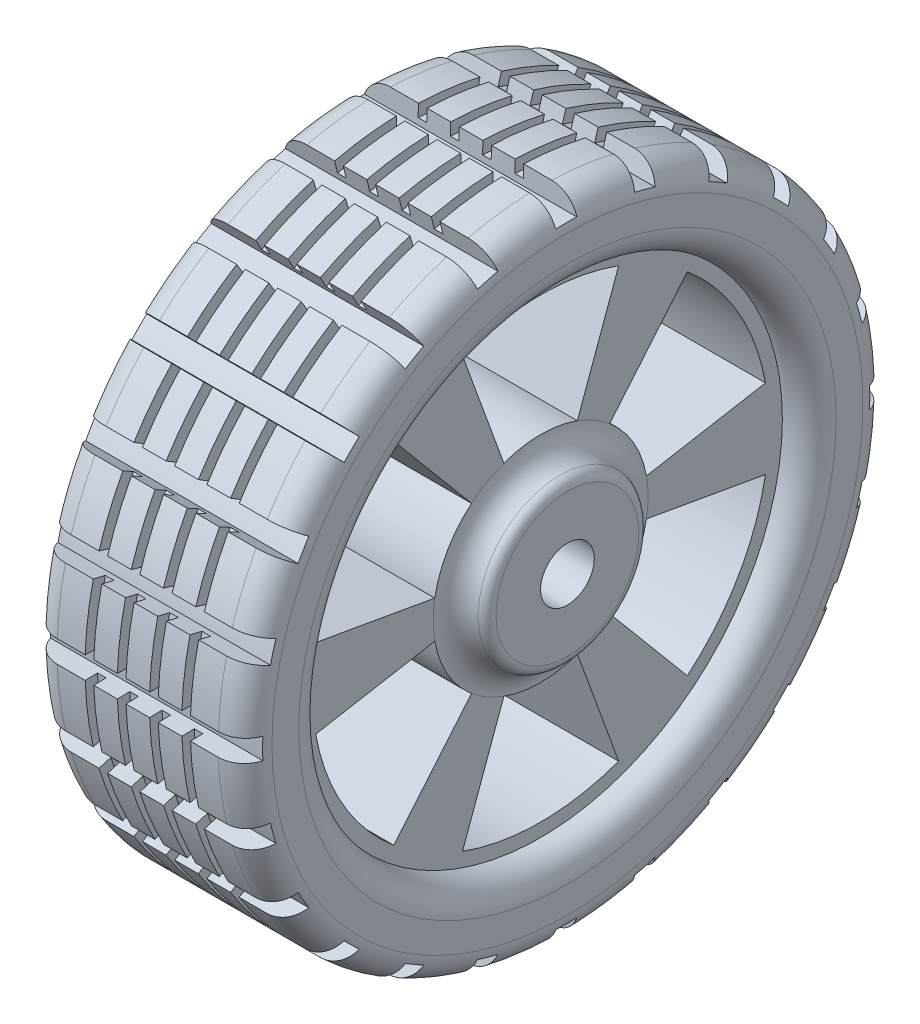
from build123d import *

# Parameters (mm, degrees)
SKETCH_2_W               = 40
SKETCH_2_H               = 60
SKETCH_4_R               = 5
CUT_EXTRUDE_2_DEPTH      = 93
FILLET_1_R               = 5
FILLET_2_R               = 5
SKETCH_5_R               = 45
SKETCH_5_R_2             = 15
CUT_EXTRUDE_3_DEPTH      = 5
FILLET_3_R               = 5
FILLET_4_R               = 5
FILLET_5_R               = 3
FILLET_6_R               = 5
PATTERN_LINEAR_1_COUNT   = 4
PATTERN_LINEAR_1_PITCH   = 6
CUT_EXTRUDE_4_DEPTH      = 116.325625947
PATTERN_START            = -19.769696137
PATTERN_CIRCULAR_1_DEPTH = 39.539392144
CUT_EXTRUDE_6_DEPTH      = 114.641343281
PATTERN_CIRCULAR_2_COUNT = 6
FILLET_7_R               = 2


# Read off the part's stored shape, not the designer's step: 阵列(圆周)1
with BuildPart() as part:
    # 草图2 → 旋转1 (revolve)
    with BuildSketch(Plane.XY, mode=Mode.PRIVATE) as revolve_1_sk:
        Rectangle(SKETCH_2_W, SKETCH_2_H)
    revolve(revolve_1_sk.sketch.rotate(Axis((-20, -30, 0), (1, 0, 0)), 90), axis=Axis((-20, -30, 0), (1, 0, 0)))

    # 草图4 → 切除-拉伸2 (cut)
    with BuildSketch(Plane(origin=(20, 0, 0), x_dir=(0, 0, -1), z_dir=(1, 0, 0))):
        with Locations((0, -30)):
            Circle(SKETCH_4_R)
    extrude(amount=-CUT_EXTRUDE_2_DEPTH, mode=Mode.SUBTRACT)

    # 圆角1
    fillet_1_edges = [part.edges().sort_by_distance(p)[0] for p in [
        (20, -30, -60),
    ]]
    fillet(fillet_1_edges, radius=FILLET_1_R)

    # 圆角2
    fillet_2_edges = [part.edges().sort_by_distance(p)[0] for p in [
        (-20, -30, -60),
    ]]
    fillet(fillet_2_edges, radius=FILLET_2_R)

    # 草图5 → 切除-拉伸3 (cut)
    with BuildSketch(Plane(origin=(20, 0, 0), x_dir=(0, 0, -1), z_dir=(1, 0, 0))):
        with Locations((0, -30)):
            Circle(SKETCH_5_R)
        with Locations((0, -30)):
            Circle(SKETCH_5_R_2, mode=Mode.SUBTRACT)
    cut_extrude_3 = extrude(amount=-CUT_EXTRUDE_3_DEPTH, mode=Mode.SUBTRACT)

    # 镜向1: 切除-拉伸3 across plane
    add(cut_extrude_3.mirror(Plane(origin=(0, 0, 0), x_dir=(0, 0, 1), z_dir=(1, 0, 0))), mode=Mode.SUBTRACT)

    # 圆角3
    fillet_3_edges = [part.edges().sort_by_distance(p)[0] for p in [
        (20, -30, 45),
    ]]
    fillet(fillet_3_edges, radius=FILLET_3_R - 0.0001)  # a hair under: the kernel refuses the full size

    # 圆角4
    fillet_4_edges = [part.edges().sort_by_distance(p)[0] for p in [
        (15, -30, 15),
    ]]
    fillet(fillet_4_edges, radius=FILLET_4_R - 0.0001)  # a hair under: the kernel refuses the full size

    # 圆角5
    fillet_5_edges = [part.edges().sort_by_distance(p)[0] for p in [
        (-15, -30, 15),
    ]]
    fillet(fillet_5_edges, radius=FILLET_5_R)

    # 圆角6
    fillet_6_edges = [part.edges().sort_by_distance(p)[0] for p in [
        (-20, -30, 45),
    ]]
    fillet(fillet_6_edges, radius=FILLET_6_R - 0.0001)  # a hair under: the kernel refuses the full size

    # 草图8 → 切除-旋转1 (revolve, cut)
    with BuildSketch(Plane.XY, mode=Mode.PRIVATE) as cut_revolve_1_sk:
        Polygon((-9.8, 27.7), (-8.2, 27.7), (-8.2, 30), (-9, 30), (-9.8, 30), align=None)
    cut_revolve_1 = revolve(cut_revolve_1_sk.sketch.rotate(Axis((-20, -30, 0), (1, 0, 0)), 90), axis=Axis((-20, -30, 0), (1, 0, 0)), mode=Mode.SUBTRACT)

    # 阵列(线性)1: 切除-旋转1 ×4
    with Locations(*[(i * PATTERN_LINEAR_1_PITCH, 0, 0) for i in range(1, PATTERN_LINEAR_1_COUNT)]):
        add(cut_revolve_1, mode=Mode.SUBTRACT)

    # 草图9 → 切除-拉伸4 (cut, through all)
    with BuildSketch(Plane.ZY.offset(20)):
        with BuildLine():
            Line((1.971821564, 26.465581727), (2.063444168, 29.964507821))
            ThreePointArc((2.063444168, 29.964507821), (0, 30), (-2.063444168, 29.964507821))
            Line((-2.063444168, 29.964507821), (-1.971821564, 26.465581727))
            ThreePointArc((-1.971821564, 26.465581727), (0, 26.5), (1.971821564, 26.465581727))
        make_face()
    extrude(amount=-CUT_EXTRUDE_4_DEPTH, mode=Mode.SUBTRACT)

    # 阵列(圆周)1 outline → 阵列(圆周)1 (cut)
    with BuildSketch(Plane.YZ.offset(PATTERN_START)):
        with BuildLine():
            ThreePointArc((24.031218712, 16.519001317), (24.574809185, 14.623276048), (25.05190866, 12.70973457))
            Line((25.05190866, 12.70973457), (28.455325414, 13.526822641))
            ThreePointArc((28.455325414, 13.526822641), (27.955549578, 15.529142706), (27.387208116, 17.513090667))
            Line((27.387208116, 17.513090667), (24.031218712, 16.519001317))
        make_face()
        with BuildLine():
            Line((20.899065014, 31.769248979), (17.914717433, 29.940438429))
            ThreePointArc((17.914717433, 29.940438429), (18.930435314, 28.25), (19.886538997, 26.525143297))
            Line((19.886538997, 26.525143297), (22.962509182, 28.195258842))
            ThreePointArc((22.962509182, 28.195258842), (21.961524227, 30), (20.899065014, 31.769248979))
        make_face()
        with BuildLine():
            Line((10.942234747, 43.860385474), (8.532907344, 41.321484141))
            ThreePointArc((8.532907344, 41.321484141), (9.951533137, 39.951533137), (11.321484141, 38.532907344))
            Line((11.321484141, 38.532907344), (13.860385474, 40.942234747))
            ThreePointArc((13.860385474, 40.942234747), (12.426406871, 42.426406871), (10.942234747, 43.860385474))
        make_face()
        with BuildLine():
            Line((-1.804741158, 52.962509182), (-3.474856703, 49.886538997))
            ThreePointArc((-3.474856703, 49.886538997), (-1.75, 48.930435314), (-0.059561571, 47.914717433))
            Line((-0.059561571, 47.914717433), (1.769248979, 50.899065014))
            ThreePointArc((1.769248979, 50.899065014), (0, 51.961524227), (-1.804741158, 52.962509182))
        make_face()
        with BuildLine():
            Line((-16.473177359, 58.455325414), (-17.29026543, 55.05190866))
            ThreePointArc((-17.29026543, 55.05190866), (-15.376723952, 54.574809185), (-13.480998683, 54.031218712))
            Line((-13.480998683, 54.031218712), (-12.486909333, 57.387208116))
            ThreePointArc((-12.486909333, 57.387208116), (-14.470857294, 57.955549578), (-16.473177359, 58.455325414))
        make_face()
        with BuildLine():
            Line((-32.063444168, 59.964507821), (-31.971821564, 56.465581727))
            ThreePointArc((-31.971821564, 56.465581727), (-30, 56.5), (-28.028178436, 56.465581727))
            Line((-28.028178436, 56.465581727), (-27.936555832, 59.964507821))
            ThreePointArc((-27.936555832, 59.964507821), (-30, 60), (-32.063444168, 59.964507821))
        make_face()
        with BuildLine():
            Line((-47.513090667, 57.387208116), (-46.519001317, 54.031218712))
            ThreePointArc((-46.519001317, 54.031218712), (-44.623276048, 54.574809185), (-42.70973457, 55.05190866))
            Line((-42.70973457, 55.05190866), (-43.526822641, 58.455325414))
            ThreePointArc((-43.526822641, 58.455325414), (-45.529142706, 57.955549578), (-47.513090667, 57.387208116))
        make_face()
        with BuildLine():
            Line((-61.769248979, 50.899065014), (-59.940438429, 47.914717433))
            ThreePointArc((-59.940438429, 47.914717433), (-58.25, 48.930435314), (-56.525143297, 49.886538997))
            Line((-56.525143297, 49.886538997), (-58.195258842, 52.962509182))
            ThreePointArc((-58.195258842, 52.962509182), (-60, 51.961524227), (-61.769248979, 50.899065014))
        make_face()
        with BuildLine():
            Line((-73.860385474, 40.942234747), (-71.321484141, 38.532907344))
            ThreePointArc((-71.321484141, 38.532907344), (-69.951533137, 39.951533137), (-68.532907344, 41.321484141))
            Line((-68.532907344, 41.321484141), (-70.942234747, 43.860385474))
            ThreePointArc((-70.942234747, 43.860385474), (-72.426406871, 42.426406871), (-73.860385474, 40.942234747))
        make_face()
        with BuildLine():
            Line((-82.962509182, 28.195258842), (-79.886538997, 26.525143297))
            ThreePointArc((-79.886538997, 26.525143297), (-78.930435314, 28.25), (-77.914717433, 29.940438429))
            Line((-77.914717433, 29.940438429), (-80.899065014, 31.769248979))
            ThreePointArc((-80.899065014, 31.769248979), (-81.961524227, 30), (-82.962509182, 28.195258842))
        make_face()
        with BuildLine():
            Line((-88.455325414, 13.526822641), (-85.05190866, 12.70973457))
            ThreePointArc((-85.05190866, 12.70973457), (-84.574809185, 14.623276048), (-84.031218712, 16.519001317))
            Line((-84.031218712, 16.519001317), (-87.387208115, 17.513090667))
            ThreePointArc((-87.387208115, 17.513090667), (-87.955549577, 15.529142706), (-88.455325414, 13.526822641))
        make_face()
        with BuildLine():
            Line((-89.964507821, -2.063444168), (-86.465581727, -1.971821564))
            ThreePointArc((-86.465581727, -1.971821564), (-86.5, 0), (-86.465581727, 1.971821564))
            Line((-86.465581727, 1.971821564), (-89.964507821, 2.063444168))
            ThreePointArc((-89.964507821, 2.063444168), (-90, 0), (-89.964507821, -2.063444168))
        make_face()
        with BuildLine():
            Line((-87.387208115, -17.513090667), (-84.031218712, -16.519001317))
            ThreePointArc((-84.031218712, -16.519001317), (-84.574809185, -14.623276048), (-85.05190866, -12.70973457))
            Line((-85.05190866, -12.70973457), (-88.455325414, -13.526822641))
            ThreePointArc((-88.455325414, -13.526822641), (-87.955549577, -15.529142706), (-87.387208115, -17.513090667))
        make_face()
        with BuildLine():
            Line((-80.899065014, -31.769248979), (-77.914717433, -29.940438429))
            ThreePointArc((-77.914717433, -29.940438429), (-78.930435314, -28.25), (-79.886538997, -26.525143297))
            Line((-79.886538997, -26.525143297), (-82.962509182, -28.195258842))
            ThreePointArc((-82.962509182, -28.195258842), (-81.961524227, -30), (-80.899065014, -31.769248979))
        make_face()
        with BuildLine():
            Line((-70.942234747, -43.860385474), (-68.532907344, -41.321484141))
            ThreePointArc((-68.532907344, -41.321484141), (-69.951533137, -39.951533137), (-71.321484141, -38.532907344))
            Line((-71.321484141, -38.532907344), (-73.860385474, -40.942234747))
            ThreePointArc((-73.860385474, -40.942234747), (-72.426406871, -42.426406871), (-70.942234747, -43.860385474))
        make_face()
        with BuildLine():
            Line((-58.195258842, -52.962509182), (-56.525143297, -49.886538997))
            ThreePointArc((-56.525143297, -49.886538997), (-58.25, -48.930435314), (-59.940438429, -47.914717433))
            Line((-59.940438429, -47.914717433), (-61.769248979, -50.899065014))
            ThreePointArc((-61.769248979, -50.899065014), (-60, -51.961524227), (-58.195258842, -52.962509182))
        make_face()
        with BuildLine():
            Line((-43.526822641, -58.455325414), (-42.70973457, -55.05190866))
            ThreePointArc((-42.70973457, -55.05190866), (-44.623276048, -54.574809185), (-46.519001317, -54.031218712))
            Line((-46.519001317, -54.031218712), (-47.513090667, -57.387208116))
            ThreePointArc((-47.513090667, -57.387208116), (-45.529142706, -57.955549578), (-43.526822641, -58.455325414))
        make_face()
        with BuildLine():
            Line((-27.936555832, -59.964507821), (-28.028178436, -56.465581727))
            ThreePointArc((-28.028178436, -56.465581727), (-30, -56.5), (-31.971821564, -56.465581727))
            Line((-31.971821564, -56.465581727), (-32.063444168, -59.964507821))
            ThreePointArc((-32.063444168, -59.964507821), (-30, -60), (-27.936555832, -59.964507821))
        make_face()
        with BuildLine():
            Line((-12.486909333, -57.387208116), (-13.480998683, -54.031218712))
            ThreePointArc((-13.480998683, -54.031218712), (-15.376723952, -54.574809185), (-17.29026543, -55.05190866))
            Line((-17.29026543, -55.05190866), (-16.473177359, -58.455325414))
            ThreePointArc((-16.473177359, -58.455325414), (-14.470857294, -57.955549578), (-12.486909333, -57.387208116))
        make_face()
        with BuildLine():
            Line((1.769248979, -50.899065014), (-0.059561571, -47.914717433))
            ThreePointArc((-0.059561571, -47.914717433), (-1.75, -48.930435314), (-3.474856703, -49.886538997))
            Line((-3.474856703, -49.886538997), (-1.804741158, -52.962509182))
            ThreePointArc((-1.804741158, -52.962509182), (0, -51.961524227), (1.769248979, -50.899065014))
        make_face()
        with BuildLine():
            Line((13.860385474, -40.942234747), (11.321484141, -38.532907344))
            ThreePointArc((11.321484141, -38.532907344), (9.951533137, -39.951533137), (8.532907344, -41.321484141))
            Line((8.532907344, -41.321484141), (10.942234747, -43.860385474))
            ThreePointArc((10.942234747, -43.860385474), (12.426406871, -42.426406871), (13.860385474, -40.942234747))
        make_face()
        with BuildLine():
            Line((22.962509182, -28.195258842), (19.886538997, -26.525143297))
            ThreePointArc((19.886538997, -26.525143297), (18.930435314, -28.25), (17.914717433, -29.940438429))
            Line((17.914717433, -29.940438429), (20.899065014, -31.769248979))
            ThreePointArc((20.899065014, -31.769248979), (21.961524227, -30), (22.962509182, -28.195258842))
        make_face()
        with BuildLine():
            Line((28.455325414, -13.526822641), (25.05190866, -12.70973457))
            ThreePointArc((25.05190866, -12.70973457), (24.574809185, -14.623276048), (24.031218712, -16.519001317))
            Line((24.031218712, -16.519001317), (27.387208116, -17.513090667))
            ThreePointArc((27.387208116, -17.513090667), (27.955549578, -15.529142706), (28.455325414, -13.526822641))
        make_face()
    extrude(amount=PATTERN_CIRCULAR_1_DEPTH, mode=Mode.SUBTRACT)

    # 草图10 → 切除-拉伸6 (cut, through all)
    with BuildSketch(Plane(origin=(15, 0, 0), x_dir=(0, 0, -1), z_dir=(1, 0, 0))):
        with BuildLine():
            Line((6.840402867, -11.206147584), (14.535856091, 9.936936383))
            ThreePointArc((14.535856091, 9.936936383), (0, 12.5), (-14.535856091, 9.936936383))
            Line((-14.535856091, 9.936936383), (-6.840402867, -11.206147584))
            ThreePointArc((-6.840402867, -11.206147584), (0, -10), (6.840402867, -11.206147584))
        make_face()
    cut_extrude_6 = extrude(amount=-CUT_EXTRUDE_6_DEPTH, mode=Mode.SUBTRACT)

    # 阵列(圆周)2: 切除-拉伸6 ×6 about axis
    pattern_circular_2_axis = Axis((0, -30, 0), (1, 0, 0))
    for i in range(1, PATTERN_CIRCULAR_2_COUNT):
        add(cut_extrude_6.rotate(pattern_circular_2_axis, i * 360 / PATTERN_CIRCULAR_2_COUNT), mode=Mode.SUBTRACT)

    # 圆角7
    fillet_7_edges = [part.edges().sort_by_distance(p)[0] for p in [
        (20, -30, 15),
    ]]
    fillet(fillet_7_edges, radius=FILLET_7_R)


solid = part.part
